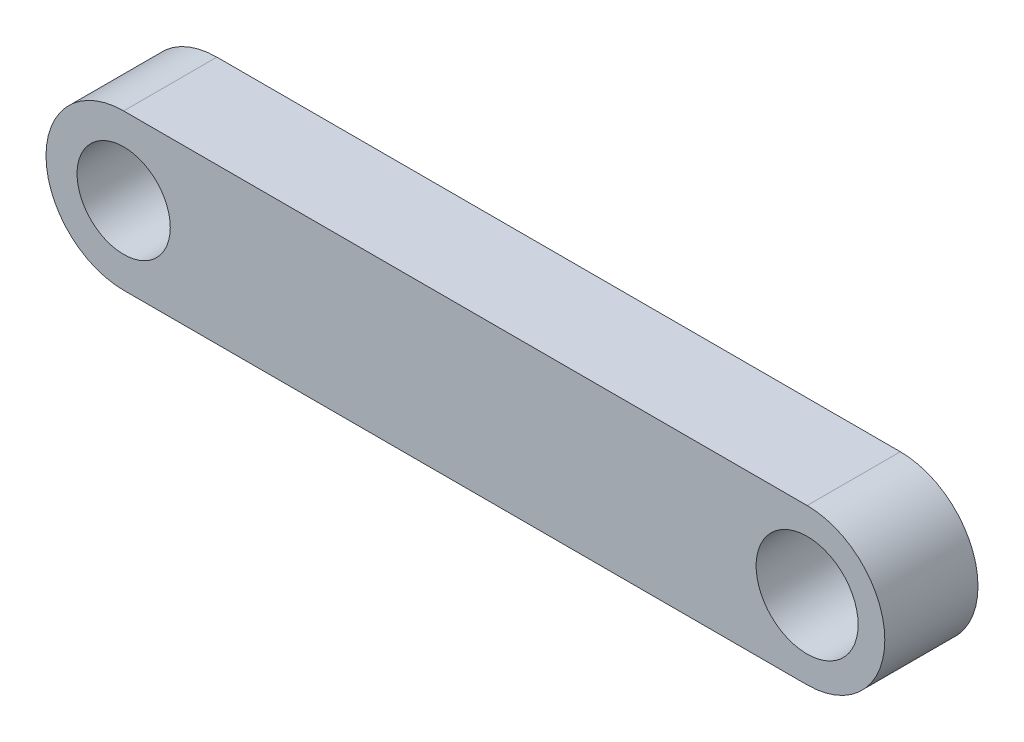
from build123d import *

# Parameters (mm, degrees)
SKETCH1_R           = 1.5
SKETCH1_R_2         = 1.641656587
BOSS_EXTRUDE1_DEPTH = 3


with BuildPart() as part:
    # Sketch1 → Boss-Extrude1 (new body)
    with BuildSketch(Plane.XY):
        with BuildLine():
            Line((0, 2.5), (22, 2.5))
            ThreePointArc((22, 2.5), (24.5, 0), (22, -2.5))
            Line((22, -2.5), (0, -2.5))
            ThreePointArc((0, -2.5), (-2.5, 0), (0, 2.5))
        make_face()
        Circle(SKETCH1_R, mode=Mode.SUBTRACT)
        with Locations((22, 0)):
            Circle(SKETCH1_R_2, mode=Mode.SUBTRACT)
    extrude(amount=BOSS_EXTRUDE1_DEPTH)


solid = part.part
